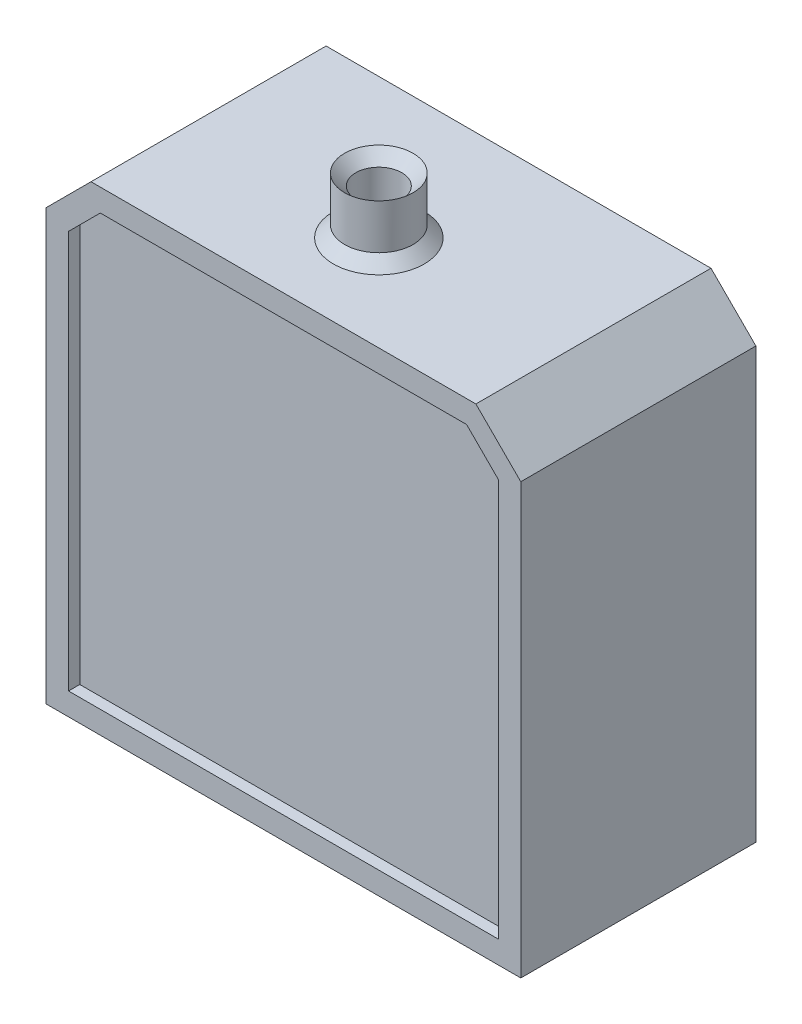
from build123d import *

# Parameters (mm, degrees)
SKETCH3_W           = 42.3
SKETCH3_H           = 42.3
BOSS_EXTRUDE1_DEPTH = 20.95
SKETCH4_R           = 4.05
CUT_EXTRUDE1_DEPTH  = 5
SKETCH5_R           = 2.5
CUT_EXTRUDE2_DEPTH  = 8.5
SKETCH6_R           = 3.05
BOSS_EXTRUDE2_DEPTH = 5
SKETCH7_R           = 2.05
CUT_EXTRUDE3_DEPTH  = 20
CHAMFER1_SIZE       = 4
CHAMFER3_SIZE       = 1
CUT_EXTRUDE4_DEPTH  = 1


with BuildPart() as part:
    # Sketch3 → Boss-Extrude1 (new body)
    with BuildSketch(Plane.XY):
        Rectangle(SKETCH3_W, SKETCH3_H)
    extrude(amount=BOSS_EXTRUDE1_DEPTH)

    # Sketch4 → Cut-Extrude1 (cut)
    with BuildSketch(Plane.XZ.offset(21.15)):
        with Locations(Location((0, 12.45, 0), (0, 0, 270))):
            Circle(SKETCH4_R)
    extrude(amount=-CUT_EXTRUDE1_DEPTH, mode=Mode.SUBTRACT)

    # Sketch5 → Cut-Extrude2 (cut)
    with BuildSketch(Plane.XY):
        Circle(SKETCH5_R)
    extrude(amount=CUT_EXTRUDE2_DEPTH, mode=Mode.SUBTRACT)

    # Sketch6 → Boss-Extrude2 (add)
    with BuildSketch(Plane(origin=(0, 21.15, 0), x_dir=(1, 0, 0), z_dir=(0, 1, 0))):
        with Locations(Location((0, -12.45, 0), (0, 0, 90))):
            Circle(SKETCH6_R)
    extrude(amount=BOSS_EXTRUDE2_DEPTH)

    # Sketch7 → Cut-Extrude3 (cut)
    with BuildSketch(Plane(origin=(0, 26.15, 0), x_dir=(1, 0, 0), z_dir=(0, 1, 0))):
        with Locations(Location((0, -12.45, 0), (0, 0, 270))):
            Circle(SKETCH7_R)
    extrude(amount=-CUT_EXTRUDE3_DEPTH, mode=Mode.SUBTRACT)

    # Chamfer1
    chamfer1_edges = [part.edges().sort_by_distance(p)[0] for p in [
        (21.15, 21.15, 10.475),
        (-21.15, 21.15, 10.475),
    ]]
    chamfer(chamfer1_edges, length=CHAMFER1_SIZE)

    # Chamfer3
    chamfer3_edges = [part.edges().sort_by_distance(p)[0] for p in [
        (0, 21.15, 15.5),
        (0, 26.15, 10.4),
    ]]
    chamfer(chamfer3_edges, length=CHAMFER3_SIZE - 0.0001)  # a hair under: the kernel refuses the full size

    # Sketch10 → Cut-Extrude4 (cut)
    with BuildSketch(Plane.XY.offset(20.95)):
        Polygon((19.15, -19.15), (19.15, 16.321572875), (16.321572875, 19.15), (-16.321572875, 19.15), (-19.15, 16.321572875), (-19.15, -19.15), align=None)
    extrude(amount=-CUT_EXTRUDE4_DEPTH, mode=Mode.SUBTRACT)


solid = part.part
